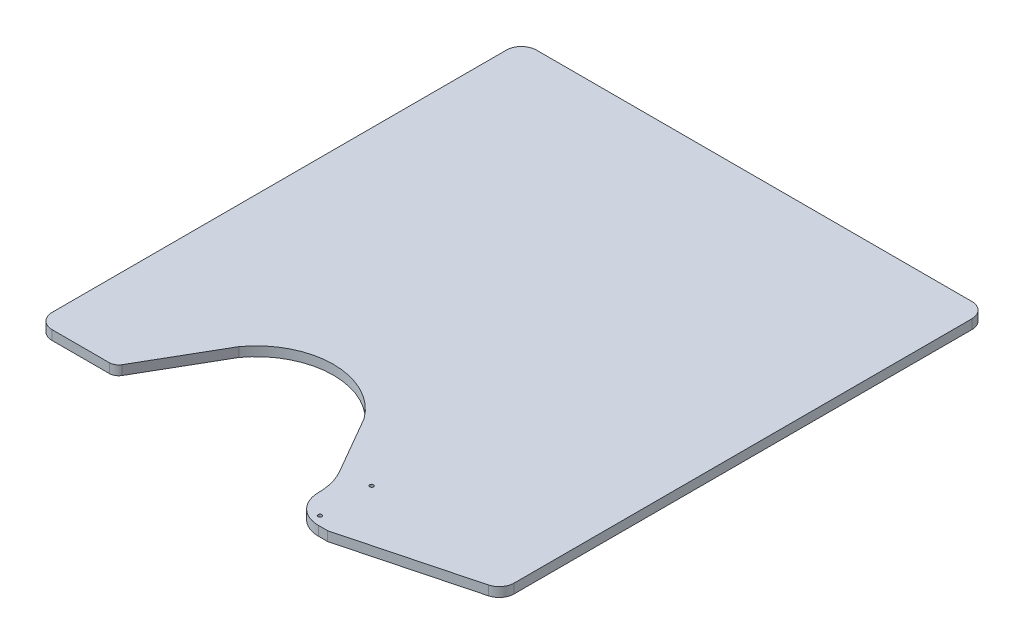
from build123d import *

# Parameters (mm, degrees)
ESQUISSE1_R        = 1
BOSS_EXTRU_1_DEPTH = 5


with BuildPart() as part:
    # Esquisse1 → Boss.-Extru.1 (new body)
    with BuildSketch(Plane(origin=(0, 0, 0), x_dir=(1, 0, 0), z_dir=(0, 1, 0))):
        with BuildLine():
            Line((-115.5, 31.2), (115.5, 31.2))
            ThreePointArc((115.5, 31.2), (121.156854249, 28.856854249), (123.5, 23.2))
            Line((123.5, 23.2), (123.5, -219.628082835))
            ThreePointArc((123.5, -219.628082835), (121.834070951, -224.514752988), (117.530113703, -227.366211701))
            Line((117.530113703, -227.366211701), (50, -245.082873123))
            Line((50, -245.082873123), (45, -245.082873123))
            ThreePointArc((45, -245.082873123), (34.393398282, -240.68947484), (30, -230.082873123))
            ThreePointArc((30, -230.082873123), (28.945508514, -222.073215083), (25.853895909, -214.609402001))
            Line((25.853895909, -214.609402001), (10.681549424, -188.330127019))
            Line((10.681549424, -188.330127019), (8.181549424, -184))
            ThreePointArc((8.181549424, -184), (-25, -167.082873123), (-58.181549424, -184))
            Line((-58.181549424, -184), (-60.681549424, -188.330127019))
            Line((-60.681549424, -188.330127019), (-75.853895909, -214.609402001))
            Line((-75.853895909, -214.609402001), (-80.871415003, -223.3))
            ThreePointArc((-80.871415003, -223.3), (-82.701542022, -225.130127019), (-85.201542022, -225.8))
            Line((-85.201542022, -225.8), (-115.5, -225.8))
            ThreePointArc((-115.5, -225.8), (-121.156854249, -223.456854249), (-123.5, -217.8))
            Line((-123.5, -217.8), (-123.5, 23.2))
            ThreePointArc((-123.5, 23.2), (-121.156854249, 28.856854249), (-115.5, 31.2))
        make_face()
        with Locations((41, -212.75)):
            Circle(ESQUISSE1_R, mode=Mode.SUBTRACT)
        with Locations((41, -240.25)):
            Circle(ESQUISSE1_R, mode=Mode.SUBTRACT)
    extrude(amount=-BOSS_EXTRU_1_DEPTH)


solid = part.part
